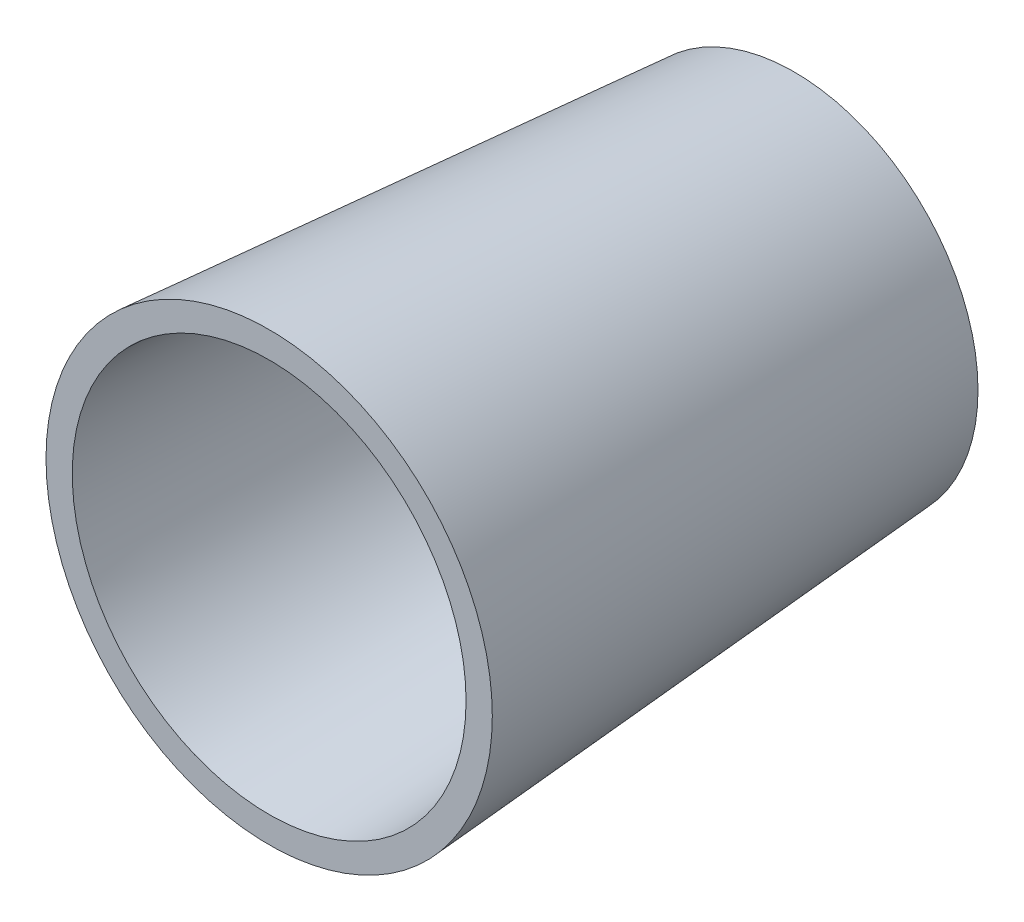
from build123d import *

# Parameters (mm, degrees)
SKETCH7_R           = 42.5
SKETCH6_R           = 35
SKETCH9_R           = 32.5
BOSS_EXTRUDE3_DEPTH = 3


# Read off the part's stored shape, not the designer's step: Cut-Loft2
with BuildPart() as part:
    # Sketch7 → Loft1 section 0
    with BuildSketch(Plane.XY.offset(100)):
        Circle(SKETCH7_R)
    # Sketch6 → Loft1 section 1
    with BuildSketch(Plane.XY):
        Circle(SKETCH6_R)
    loft()

    # Cut-Loft2 outline → Cut-Loft2 (revolve, cut)
    with BuildSketch(Plane.XZ):
        Polygon((0, 100), (0, 0), (32.5, 0), (37.5, 100), align=None)
    revolve(axis=Axis((0, 0, 0), (0, 0, 1)), mode=Mode.SUBTRACT)


with BuildPart() as body_2:
    # Sketch9 → Boss-Extrude3 (new body)
    with BuildSketch(Plane(origin=(0, 0, 0), x_dir=(-1, 0, 0), z_dir=(0, 0, -1))):
        Circle(SKETCH9_R)
    extrude(amount=-BOSS_EXTRUDE3_DEPTH)


solid = Compound([part.part, body_2.part])
